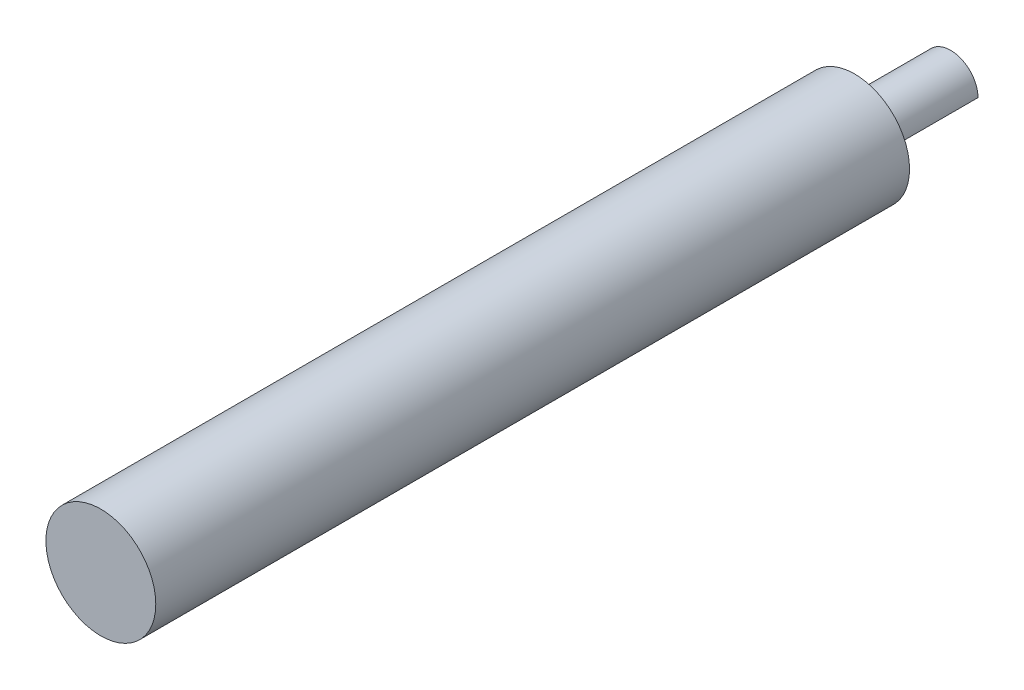
from build123d import *

# Parameters (mm, degrees)
SKETCH1_R               = 3.1623
BOSS_EXTRUDE1_DEPTH     = 11.0998
CUT_EXTRUDE1_DEPTH      = 12.96686436
CUT_EXTRUDE1_DEPTH_BACK = 12.96686436
SKETCH3_R               = 6.35
BOSS_EXTRUDE2_DEPTH     = 87.122


with BuildPart() as part:
    # Sketch1 → Boss-Extrude1 (new body)
    with BuildSketch(Plane.XY):
        Circle(SKETCH1_R)
    extrude(amount=BOSS_EXTRUDE1_DEPTH)

    # Sketch2 → Cut-Extrude1 (cut, two sides: drawn at the far end of the back side and taken through both)
    with BuildSketch(Plane(origin=(0, 0, 0), x_dir=(-1, 0, 0), z_dir=(0, 0, -1)).offset(-CUT_EXTRUDE1_DEPTH_BACK)):
        Polygon((17.073178183, -20.234228338), (0.001249598, -3.162299753), (-3.162299753, 0.001249598), (-20.234228338, 17.073178183), (-54.378085507, -17.070678986), (-17.070678986, -54.378085507), align=None)
    extrude(amount=CUT_EXTRUDE1_DEPTH + CUT_EXTRUDE1_DEPTH_BACK, mode=Mode.SUBTRACT)

    # Sketch3 → Boss-Extrude2 (add)
    with BuildSketch(Plane.XY.offset(11.0998)):
        Circle(SKETCH3_R)
    extrude(amount=BOSS_EXTRUDE2_DEPTH)


solid = part.part
